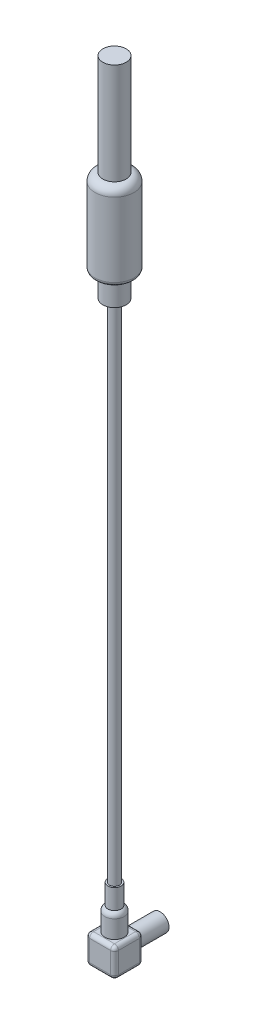
from build123d import *

# Parameters (mm, degrees)
SKETCH1_R                       = 1.15
BOSS_EXTRUDE1_DEPTH             = 4
SKETCH2_W                       = 3.7
SKETCH2_H                       = 3.7
BOSS_EXTRUDE2_DEPTH             = 3.7
FILLET1_R                       = 0.5
SKETCH3_R                       = 1.25
BOSS_EXTRUDE3_DEPTH             = 3
FILLET2_R                       = 0.7
SKETCH4_R                       = 0.85
BOSS_EXTRUDE4_DEPTH             = 2.5
BOSS_EXTRUDE4_DIRECTION_2_REACH = 12.373
SKETCH5_R                       = 0.65
BOSS_EXTRUDE5_DEPTH             = 65
SKETCH6_R                       = 1.5
BOSS_EXTRUDE6_DEPTH             = 3
SKETCH7_R                       = 2.5
BOSS_EXTRUDE7_DEPTH             = 11
SKETCH8_R                       = 1.5
BOSS_EXTRUDE8_DEPTH             = 13
FILLET3_R                       = 1
FILLET4_R                       = 0.5
FILLET5_R                       = 0.5


with BuildPart() as part:
    # Sketch1 → Boss-Extrude1 (new body)
    with BuildSketch(Plane.XY):
        Circle(SKETCH1_R)
    extrude(amount=BOSS_EXTRUDE1_DEPTH)

    # Sketch2 → Boss-Extrude2 (add)
    with BuildSketch(Plane.XY.offset(4)):
        Rectangle(SKETCH2_W, SKETCH2_H)
    extrude(amount=BOSS_EXTRUDE2_DEPTH)

    # Fillet1
    fillet1_edges = [part.edges().sort_by_distance(p)[0] for p in [
        (-1.85, 0, 4),
        (-1.85, 1.85, 5.85),
        (0, -1.85, 4),
        (-1.85, -1.85, 5.85),
        (1.85, 0, 4),
        (1.85, -1.85, 5.85),
        (0, 1.85, 4),
        (1.85, 1.85, 5.85),
        (-1.85, 0, 7.7),
        (0, -1.85, 7.7),
        (1.85, 0, 7.7),
        (0, 1.85, 7.7),
    ]]
    fillet(fillet1_edges, radius=FILLET1_R)

    # Sketch3 → Boss-Extrude3 (add)
    with BuildSketch(Plane(origin=(0, 1.85, 0), x_dir=(1, 0, 0), z_dir=(0, 1, 0))):
        with Locations((0, -5.85)):
            Circle(SKETCH3_R)
    extrude(amount=BOSS_EXTRUDE3_DEPTH)

    # Fillet2
    fillet2_edges = [part.edges().sort_by_distance(p)[0] for p in [
        (-1.25, 4.85, 5.85),
    ]]
    fillet(fillet2_edges, radius=FILLET2_R)

    # Sketch4 → Boss-Extrude4 (add)
    with BuildSketch(Plane(origin=(0, 4.85, 0), x_dir=(1, 0, 0), z_dir=(0, 1, 0))):
        with Locations(Location((0, -5.85, 0), (0, 0, 180))):
            Circle(SKETCH4_R)
    extrude(amount=BOSS_EXTRUDE4_DEPTH)

    # Sketch4 → Boss-Extrude4 direction 2 (add, up to next)
    with BuildSketch(Plane(origin=(0, 4.85, 0), x_dir=(1, 0, 0), z_dir=(0, 1, 0)), mode=Mode.PRIVATE) as boss_extrude4_direction_2_sk1:
        with Locations(Location((0, -5.85, 0), (0, 0, 180))):
            Circle(SKETCH4_R)
    boss_extrude4_direction_2_tool1 = extrude(boss_extrude4_direction_2_sk1.sketch, amount=-BOSS_EXTRUDE4_DIRECTION_2_REACH, mode=Mode.PRIVATE) - part.part
    add(boss_extrude4_direction_2_tool1.solids().sort_by_distance((0, 4.85, 5.85))[0])

    # Sketch5 → Boss-Extrude5 (add)
    with BuildSketch(Plane(origin=(0, 7.35, 0), x_dir=(1, 0, 0), z_dir=(0, 1, 0))):
        with Locations(Location((0, -5.85, 0), (0, 0, 180))):
            Circle(SKETCH5_R)
    extrude(amount=BOSS_EXTRUDE5_DEPTH)

    # Sketch6 → Boss-Extrude6 (add)
    with BuildSketch(Plane(origin=(0, 72.35, 0), x_dir=(1, 0, 0), z_dir=(0, 1, 0))):
        with Locations(Location((0, -5.85, 0), (0, 0, 180))):
            Circle(SKETCH6_R)
    extrude(amount=BOSS_EXTRUDE6_DEPTH)

    # Sketch7 → Boss-Extrude7 (add)
    with BuildSketch(Plane(origin=(0, 75.35, 0), x_dir=(1, 0, 0), z_dir=(0, 1, 0))):
        with Locations(Location((0, -5.85, 0), (0, 0, 180))):
            Circle(SKETCH7_R)
    extrude(amount=BOSS_EXTRUDE7_DEPTH)

    # Sketch8 → Boss-Extrude8 (add)
    with BuildSketch(Plane(origin=(0, 86.35, 0), x_dir=(1, 0, 0), z_dir=(0, 1, 0))):
        with Locations(Location((0, -5.85, 0), (0, 0, 180))):
            Circle(SKETCH8_R)
    extrude(amount=BOSS_EXTRUDE8_DEPTH)

    # Fillet3
    fillet3_edges = [part.edges().sort_by_distance(p)[0] for p in [
        (2.5, 86.35, 5.85),
    ]]
    fillet(fillet3_edges, radius=FILLET3_R - 0.0001)  # a hair under: the kernel refuses the full size

    # Fillet4
    fillet4_edges = [part.edges().sort_by_distance(p)[0] for p in [
        (2.5, 75.35, 5.85),
    ]]
    fillet(fillet4_edges, radius=FILLET4_R)

    # Fillet5
    fillet5_edges = [part.edges().sort_by_distance(p)[0] for p in [
        (1.5, 75.35, 5.85),
    ]]
    fillet(fillet5_edges, radius=FILLET5_R - 0.0001)  # a hair under: the kernel refuses the full size


solid = part.part
